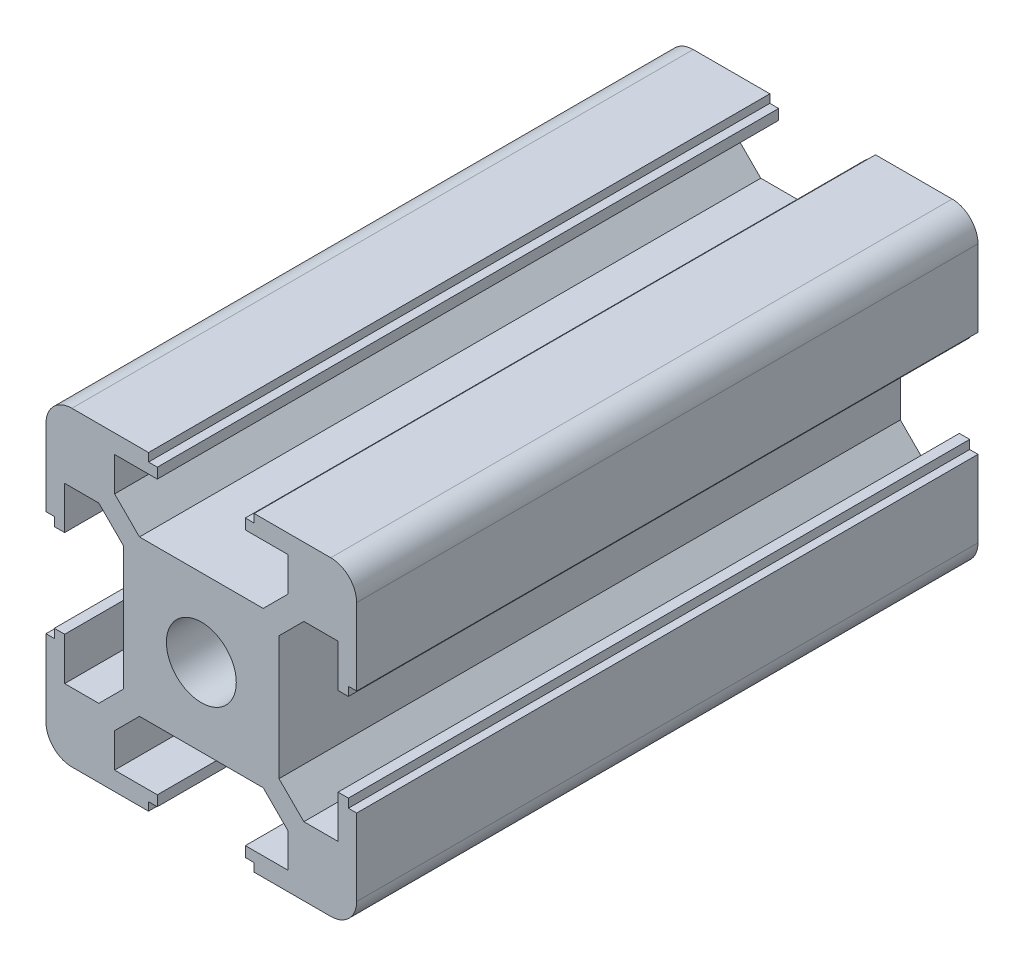
from build123d import *

# Parameters (mm, degrees)
SKETCH1_W                = 30
SKETCH1_H                = 30
BOSS_EXTRUDE1_DEPTH      = 30
SKETCH2_R                = 3.375
CUT_EXTRUDE1_DEPTH       = 64.639610307
FILLET1_R                = 2.5
CUT_EXTRUDE2_DEPTH       = 64.639610307
CIRPATTERN1_COPY_1_DEPTH = 64.639610307
CIRPATTERN1_COPY_2_DEPTH = 64.639610307
CIRPATTERN1_COPY_3_DEPTH = 64.639610307
CIRPATTERN1_COPY_4_DEPTH = 64.639610307
CIRPATTERN1_COPY_5_DEPTH = 64.639610307
CIRPATTERN1_COPY_6_DEPTH = 64.639610307


with BuildPart() as part:
    # Sketch1 → Boss-Extrude1 (new, symmetric)
    with BuildSketch(Plane.XY):
        Rectangle(SKETCH1_W, SKETCH1_H)
    extrude(amount=BOSS_EXTRUDE1_DEPTH, both=True)

    # Sketch2 → Cut-Extrude1 (cut, through all)
    with BuildSketch(Plane.XY.offset(30)):
        Circle(SKETCH2_R)
    extrude(amount=-CUT_EXTRUDE1_DEPTH, mode=Mode.SUBTRACT)

    # Fillet1
    fillet1_edges = [part.edges().sort_by_distance(p)[0] for p in [
        (15, -15, 0),
        (-15, -15, 0),
        (15, 15, 0),
        (-15, 15, 0),
    ]]
    fillet(fillet1_edges, radius=FILLET1_R)

    # Sketch3 → Cut-Extrude2 (cut, through all)
    with BuildSketch(Plane.XY.offset(30)):
        Polygon((0, 15), (-5.1, 15), (-5.1, 14.2), (-4.25, 14.2), (-4.25, 13.2), (-8.375, 13.2), (-8.375, 9.9), (-5.975, 7.5), (0, 7.5), align=None)
    cut_extrude2 = extrude(amount=-CUT_EXTRUDE2_DEPTH, mode=Mode.SUBTRACT)

    # Mirror1: Cut-Extrude2 across plane
    add(cut_extrude2.mirror(Plane(origin=(0, 0, 0), x_dir=(0, 0, 1), z_dir=(1, 0, 0))), mode=Mode.SUBTRACT)

    # CirPattern1 copy 1 sketch → CirPattern1 copy 1 (cut, through all)
    with BuildSketch(Plane(origin=(0, 0, 30), x_dir=(0, -1, 0), z_dir=(0, 0, 1))):
        Polygon((0, -15), (-5.1, -15), (-5.1, -14.2), (-4.25, -14.2), (-4.25, -13.2), (-8.375, -13.2), (-8.375, -9.9), (-5.975, -7.5), (0, -7.5), align=None)
    extrude(amount=-CIRPATTERN1_COPY_1_DEPTH, mode=Mode.SUBTRACT)

    # CirPattern1 copy 2 sketch → CirPattern1 copy 2 (cut, through all)
    with BuildSketch(Plane.XY.offset(30)):
        Polygon((0, -15), (-5.1, -15), (-5.1, -14.2), (-4.25, -14.2), (-4.25, -13.2), (-8.375, -13.2), (-8.375, -9.9), (-5.975, -7.5), (0, -7.5), align=None)
    extrude(amount=-CIRPATTERN1_COPY_2_DEPTH, mode=Mode.SUBTRACT)

    # CirPattern1 copy 3 sketch → CirPattern1 copy 3 (cut, through all)
    with BuildSketch(Plane(origin=(0, 0, 30), x_dir=(0, 1, 0), z_dir=(0, 0, 1))):
        Polygon((0, -15), (-5.1, -15), (-5.1, -14.2), (-4.25, -14.2), (-4.25, -13.2), (-8.375, -13.2), (-8.375, -9.9), (-5.975, -7.5), (0, -7.5), align=None)
    extrude(amount=-CIRPATTERN1_COPY_3_DEPTH, mode=Mode.SUBTRACT)

    # CirPattern1 copy 4 sketch → CirPattern1 copy 4 (cut, through all)
    with BuildSketch(Plane(origin=(0, 0, 30), x_dir=(0, 1, 0), z_dir=(0, 0, 1))):
        Polygon((0, 15), (-5.1, 15), (-5.1, 14.2), (-4.25, 14.2), (-4.25, 13.2), (-8.375, 13.2), (-8.375, 9.9), (-5.975, 7.5), (0, 7.5), align=None)
    extrude(amount=-CIRPATTERN1_COPY_4_DEPTH, mode=Mode.SUBTRACT)

    # CirPattern1 copy 5 sketch → CirPattern1 copy 5 (cut, through all)
    with BuildSketch(Plane(origin=(0, 0, 30), x_dir=(-1, 0, 0), z_dir=(0, 0, 1))):
        Polygon((0, 15), (-5.1, 15), (-5.1, 14.2), (-4.25, 14.2), (-4.25, 13.2), (-8.375, 13.2), (-8.375, 9.9), (-5.975, 7.5), (0, 7.5), align=None)
    extrude(amount=-CIRPATTERN1_COPY_5_DEPTH, mode=Mode.SUBTRACT)

    # CirPattern1 copy 6 sketch → CirPattern1 copy 6 (cut, through all)
    with BuildSketch(Plane(origin=(0, 0, 30), x_dir=(0, -1, 0), z_dir=(0, 0, 1))):
        Polygon((0, 15), (-5.1, 15), (-5.1, 14.2), (-4.25, 14.2), (-4.25, 13.2), (-8.375, 13.2), (-8.375, 9.9), (-5.975, 7.5), (0, 7.5), align=None)
    extrude(amount=-CIRPATTERN1_COPY_6_DEPTH, mode=Mode.SUBTRACT)


solid = part.part
